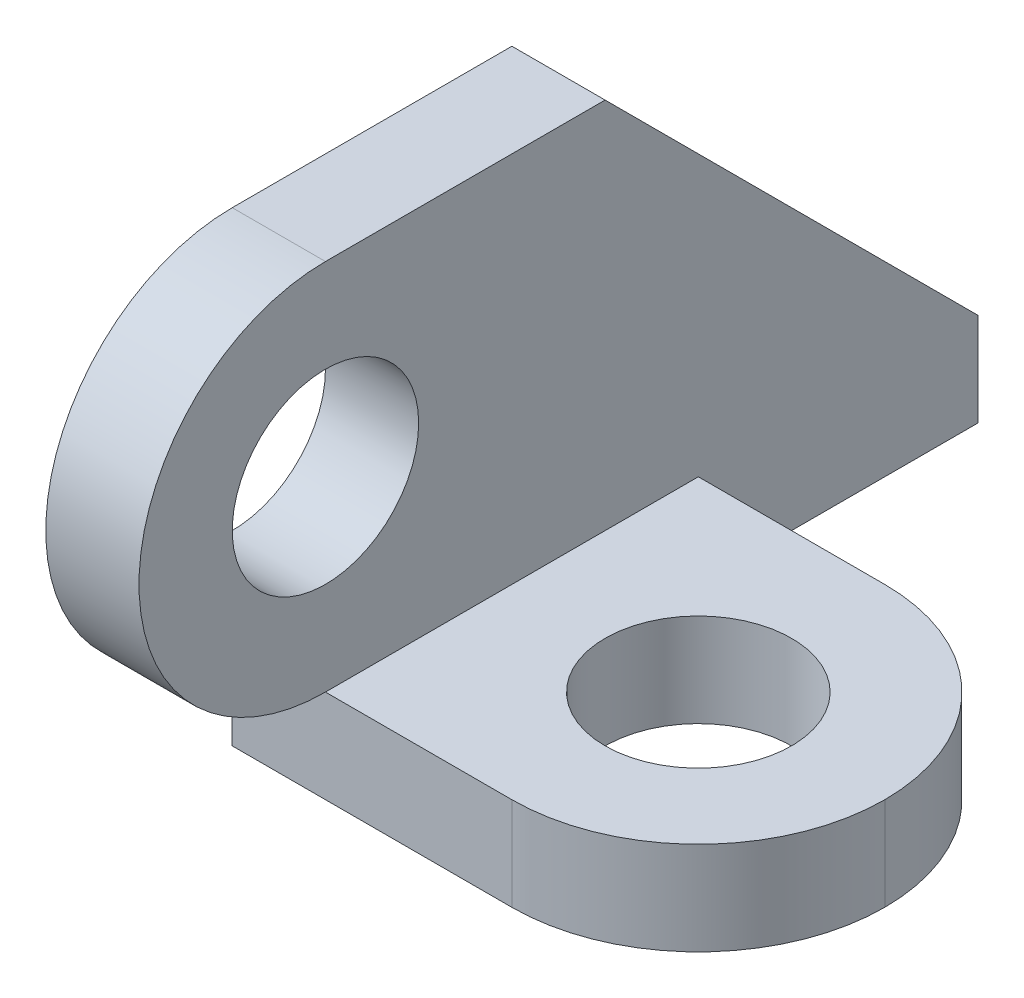
from build123d import *

# Parameters (mm, degrees)
SKETCH1_R           = 10
BOSS_EXTRUDE1_DEPTH = 10
SKETCH1_3_W         = 40
SKETCH1_3_H         = 10
BOSS_EXTRUDE2_DEPTH = 50
FILLET1_R           = 20
SKETCH2_R           = 10
CUT_EXTRUDE1_DEPTH  = 10


with BuildPart() as part:
    # Sketch1 → Boss-Extrude1 (new body)
    with BuildSketch(Plane(origin=(0, 0, 0), x_dir=(0, 0, -1), z_dir=(1, 0, 0))):
        with BuildLine():
            ThreePointArc((0, 20), (-20, 0), (0, -20))
            Line((0, -20), (40, -20))
            Line((40, -20), (40, -30))
            Line((40, -30), (70, -30))
            Line((70, -30), (70, -20))
            Line((70, -20), (30, 20))
            Line((30, 20), (0, 20))
        make_face()
        Circle(SKETCH1_R, mode=Mode.SUBTRACT)
    extrude(amount=BOSS_EXTRUDE1_DEPTH)

    # Sketch1<3> → Boss-Extrude2 (add)
    with BuildSketch(Plane(origin=(0, 0, 0), x_dir=(0, 0, -1), z_dir=(1, 0, 0))):
        with Locations((20, -25)):
            Rectangle(SKETCH1_3_W, SKETCH1_3_H)
    extrude(amount=BOSS_EXTRUDE2_DEPTH)

    # Fillet1
    fillet1_edges = [part.edges().sort_by_distance(p)[0] for p in [
        (50, -25, -40),
        (50, -25, 0),
    ]]
    fillet(fillet1_edges, radius=FILLET1_R - 0.0001)  # a hair under: the kernel refuses the full size

    # Sketch2 → Cut-Extrude1 (cut)
    with BuildSketch(Plane(origin=(0, -20, 0), x_dir=(1, 0, 0), z_dir=(0, 1, 0))):
        with Locations(Location((30, 20, 0), (0, 0, 270))):
            Circle(SKETCH2_R)
    extrude(amount=-CUT_EXTRUDE1_DEPTH, mode=Mode.SUBTRACT)


solid = part.part
